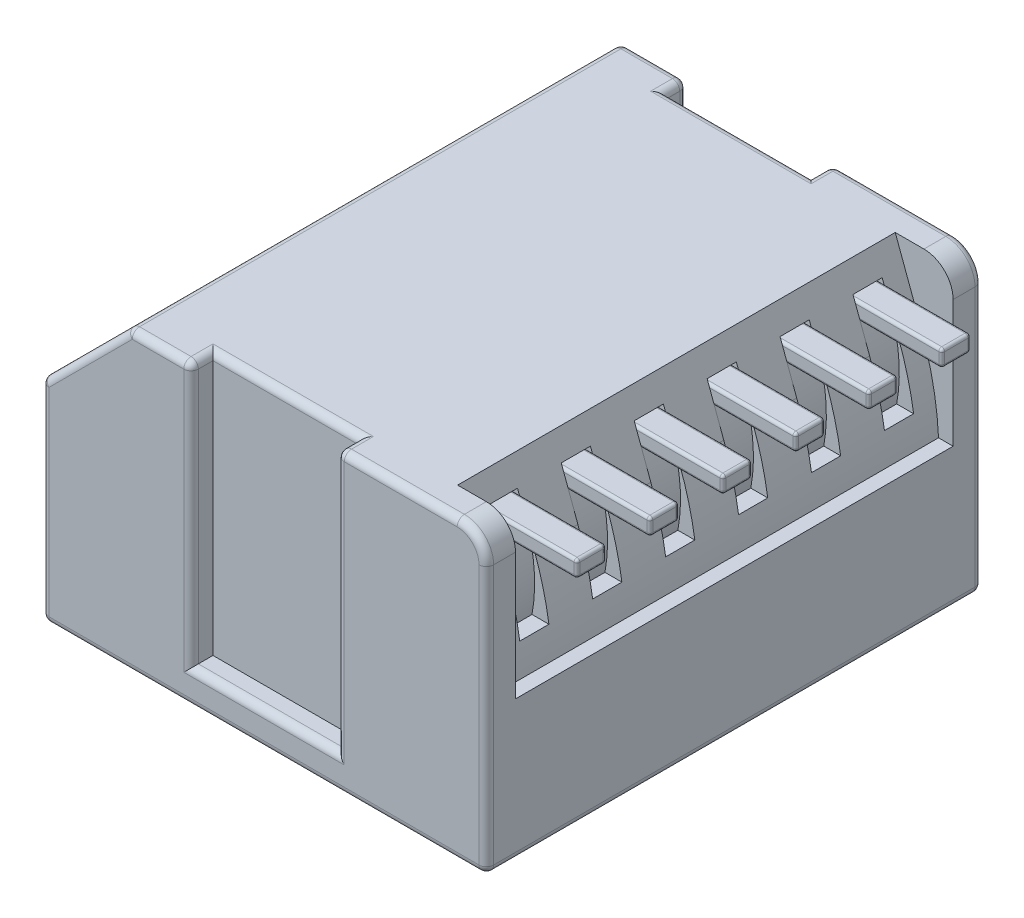
from build123d import *

# Parameters (mm, degrees)
SKETCH1_W           = 15.24
SKETCH1_H           = 10.16
BOSS_EXTRUDE1_DEPTH = 8.5
CUT_EXTRUDE1_DEPTH  = 7.5
SKETCH3_W           = 5
SKETCH3_H           = 1.830710035
CUT_EXTRUDE2_DEPTH  = 9
CHAMFER1_SIZE       = 3
FILLET1_R           = 1
SHELL1_START        = -7
SHELL1_DEPTH        = 14
SHELL1_START_2      = -7.75
SHELL1_2_DEPTH      = 15.5
CUT_EXTRUDE3_START  = -5.3537
SKETCH5_W           = 0.980788141
SKETCH5_H           = 15
CUT_EXTRUDE3_DEPTH  = 7
FILLET2_R           = 10
FILLET3_R           = 0.25
SKETCH6_W           = 1
SKETCH6_H           = 3.5
CUT_EXTRUDE4_DEPTH  = 12
BOSS_EXTRUDE4_DEPTH = 1
FILLET4_R           = 0.1
LPATTERN2_COUNT     = 6
LPATTERN2_PITCH     = 2.5


# Read off the part's stored shape, not the designer's step: Shell1
with BuildPart() as part:
    # Sketch1 → Boss-Extrude1 (new, symmetric)
    with BuildSketch(Plane.XY):
        Rectangle(SKETCH1_W, SKETCH1_H)
    extrude(amount=BOSS_EXTRUDE1_DEPTH, both=True)

    # Sketch2 → Cut-Extrude1 (cut, symmetric)
    with BuildSketch(Plane.XY):
        Polygon((5.12, 6.47230306), (7.62, -0.273703491), (11.048472565, -0.273703491), (11.048472565, 6.47230306), align=None)
    extrude(amount=CUT_EXTRUDE1_DEPTH, both=True, mode=Mode.SUBTRACT)

    # Sketch3 → Cut-Extrude2 (cut)
    with BuildSketch(Plane(origin=(0, 5.08, 0), x_dir=(1, 0, 0), z_dir=(0, 1, 0))):
        with Locations((0, 8.665355018)):
            Rectangle(SKETCH3_W, SKETCH3_H)
        with Locations((0, -8.665355018)):
            Rectangle(SKETCH3_W, SKETCH3_H)
    extrude(amount=-CUT_EXTRUDE2_DEPTH, mode=Mode.SUBTRACT)

    # Chamfer1
    chamfer1_edges = [part.edges().sort_by_distance(p)[0] for p in [
        (-7.62, 5.08, 0),
    ]]
    chamfer(chamfer1_edges, length=CHAMFER1_SIZE)

    # Fillet1
    fillet1_edges = [part.edges().sort_by_distance(p)[0] for p in [
        (7.62, 5.08, -8),
        (7.62, 5.08, 8),
    ]]
    fillet(fillet1_edges, radius=FILLET1_R)

    # Shell1 outline → Shell1 (cut)
    with BuildSketch(Plane.XY.offset(SHELL1_START)):
        Polygon((-6.87, 1.769339828), (-6.87, -4.33), (6.87, -4.33), (6.87, -0.408205117), (5.114070369, 4.33), (-4.309339828, 4.33), align=None)
    extrude(amount=SHELL1_DEPTH, mode=Mode.SUBTRACT)

    # Shell1 2 outline → Shell1 2 (cut)
    with BuildSketch(Plane.XY.offset(SHELL1_START_2)):
        Polygon((-6.87, 1.769339828), (-6.87, -4.33), (-3.25, -4.33), (-3.25, 4.33), (-4.309339828, 4.33), align=None)
        Polygon((3.25, 4.33), (3.25, -4.33), (6.87, -4.33), (6.87, -0.408205117), (5.114070369, 4.33), align=None)
    extrude(amount=SHELL1_2_DEPTH, mode=Mode.SUBTRACT)

    # Sketch5 → Cut-Extrude3 (cut)
    with BuildSketch(Plane(origin=(0, 5.08, 0), x_dir=(1, 0, 0), z_dir=(0, 1, 0)).offset(CUT_EXTRUDE3_START)):
        with Locations((7.61039407, 0)):
            Rectangle(SKETCH5_W, SKETCH5_H)
    extrude(amount=CUT_EXTRUDE3_DEPTH, mode=Mode.SUBTRACT)

    # Fillet2
    # the kernel refuses this fillet: 10 mm, written as the material it takes off along each edge
    with BuildSketch(Plane(origin=(7.12, 1.07549782, -7.5), x_dir=(0, -1, 0), z_dir=(0, 0, 1))) as fillet2_piece_1:
        with BuildLine():
            CenterArc((1.823757031, -9.988733331), FILLET2_R, 92.720045598, 17.61413716)
            Line((-1.651194328, -0.611915478), (0, 0))
            Line((0, 0), (1.34919782, 0))
        make_face()
    extrude(amount=15, mode=Mode.SUBTRACT)

    # Fillet3
    fillet3_edges = [part.edges().sort_by_distance(p)[0] for p in [
        (7.62, -0.5, 8.5),
        (-3.56, 5.08, -8.5),
        (0, -3.92, -8.5),
        (2.5, 0.58, -8.5),
        (-2.5, 0.58, -8.5),
        (-3.56, 5.08, 8.5),
        (0, -3.92, 8.5),
        (2.5, 0.58, 8.5),
        (-2.5, 0.58, 8.5),
        (2.5, 5.08, -8.125),
        (-2.5, 5.08, -8.125),
        (0, 5.08, -7.75),
        (7.62, -0.5, -8.5),
        (0, -5.08, -8.5),
        (2.5, 5.08, 8.125),
        (0, 5.08, 7.75),
        (-2.5, 5.08, 8.125),
        (-7.62, -1.5, -8.5),
        (-7.62, -1.5, 8.5),
        (-7.62, 2.08, 0),
        (-6.12, 3.58, -8.5),
        (-4.62, 5.08, 0),
        (-6.12, 3.58, 8.5),
        (7.62, -5.08, 0),
        (-7.62, -5.08, 0),
        (0, -5.08, 8.5),
        (4.56, 5.08, 8.5),
        (4.56, 5.08, -8.5),
        (7.327106781, 4.787106781, -8.5),
        (7.327106781, 4.787106781, 8.5),
    ]]
    fillet(fillet3_edges, radius=FILLET3_R)

    # Sketch6 → Cut-Extrude4 (cut)
    with BuildSketch(Plane(origin=(0, 0, 0), x_dir=(0, 0, -1), z_dir=(1, 0, 0))):
        with Locations((-3.75, 2.514493676)):
            Rectangle(SKETCH6_W, SKETCH6_H)
        with Locations((-6.25, 2.514493676)):
            Rectangle(SKETCH6_W, SKETCH6_H)
        with Locations((-1.25, 2.514493676)):
            Rectangle(SKETCH6_W, SKETCH6_H)
        with Locations((1.25, 2.514493676)):
            Rectangle(SKETCH6_W, SKETCH6_H)
        with Locations((3.75, 2.514493676)):
            Rectangle(SKETCH6_W, SKETCH6_H)
        with Locations((6.25, 2.514493676)):
            Rectangle(SKETCH6_W, SKETCH6_H)
    extrude(amount=CUT_EXTRUDE4_DEPTH, mode=Mode.SUBTRACT)


with BuildPart() as body_2:
    # Sketch7 → Boss-Extrude4 (new body)
    with BuildSketch(Plane.XY.offset(5.75)):
        with BuildLine():
            Line((8.977597948, 4.134603679), (5.977597948, 4.134603679))
            Line((5.977597948, 4.134603679), (5.186482217, 4.134603679))
            Line((5.186482217, 4.134603679), (5.257608407, 0.764493676))
            Line((5.257608407, 0.764493676), (6.43541, 0.764493676))
            ThreePointArc((6.43541, 0.764493676), (6.506573791, 2.18123399), (6.19718999, 3.565610769))
            Line((6.19718999, 3.565610769), (8.977597948, 3.565610769))
            Line((8.977597948, 3.565610769), (8.977597948, 4.134603679))
        make_face()
    extrude(amount=BOSS_EXTRUDE4_DEPTH)

    # Fillet4
    fillet4_edges = [body_2.edges().sort_by_distance(p)[0] for p in [
        (8.977597948, 3.850107224, 5.75),
        (8.977597948, 3.565610769, 6.25),
        (8.977597948, 4.134603679, 6.25),
        (7.587393969, 3.565610769, 6.75),
        (8.977597948, 3.850107224, 6.75),
        (7.587393969, 3.565610769, 5.75),
        (7.082040083, 4.134603679, 6.75),
        (7.082040083, 4.134603679, 5.75),
    ]]
    fillet(fillet4_edges, radius=FILLET4_R)


with BuildPart() as lpattern2_1:
    # LPattern2: pattern copy
    add(body_2.part.moved(Location(Vector(0, 0, -1) * (1 * LPATTERN2_PITCH))))


with BuildPart() as lpattern2_2:
    # LPattern2: pattern copy
    add(body_2.part.moved(Location(Vector(0, 0, -1) * (2 * LPATTERN2_PITCH))))


with BuildPart() as lpattern2_3:
    # LPattern2: pattern copy
    add(body_2.part.moved(Location(Vector(0, 0, -1) * (3 * LPATTERN2_PITCH))))


with BuildPart() as lpattern2_4:
    # LPattern2: pattern copy
    add(body_2.part.moved(Location(Vector(0, 0, -1) * (4 * LPATTERN2_PITCH))))


with BuildPart() as lpattern2_5:
    # LPattern2: pattern copy
    add(body_2.part.moved(Location(Vector(0, 0, -1) * (5 * LPATTERN2_PITCH))))


solid = Compound([part.part, body_2.part, lpattern2_1.part, lpattern2_2.part, lpattern2_3.part, lpattern2_4.part, lpattern2_5.part])
